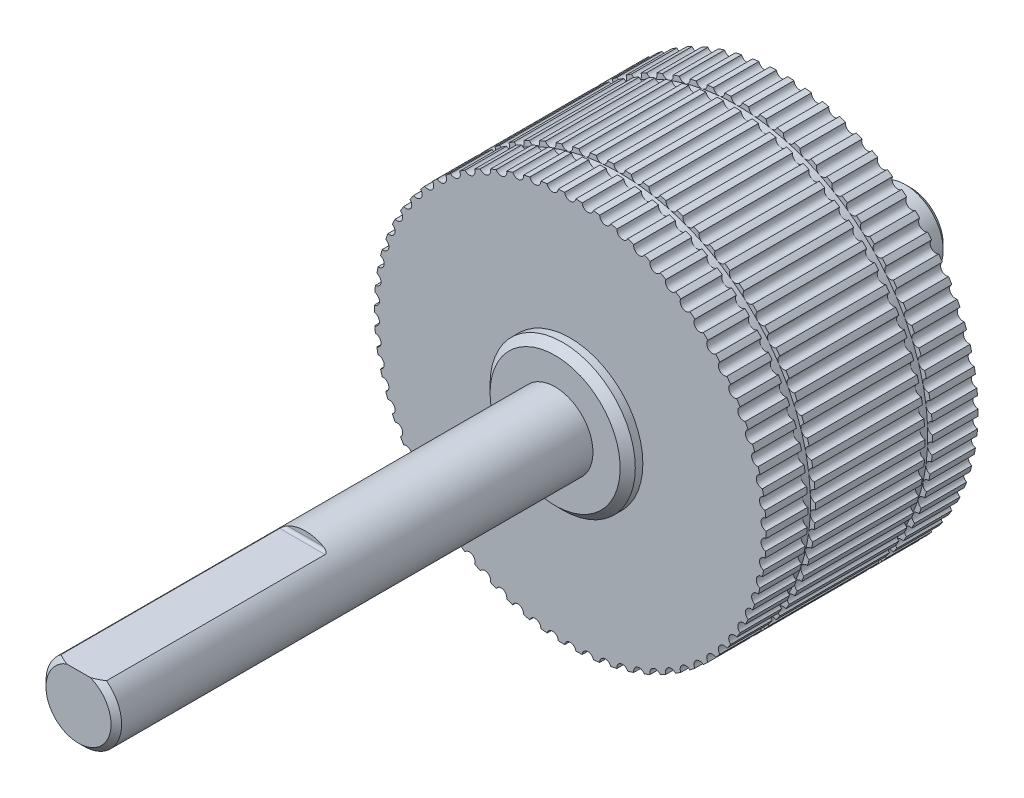
from build123d import *

# Parameters (mm, degrees)
CHAMFER1_SIZE            = 0.5
SKETCH3_R                = 0.375
CUT_EXTRUDE1_DEPTH       = 14
CIRPATTERN1_COUNT        = 70
CUT_EXTRUDE2_START       = -3
SKETCH4_R                = 13
SKETCH4_R_2              = 12.625
CUT_EXTRUDE2_DEPTH       = 0.25
LPATTERN1_COUNT          = 2
LPATTERN1_PITCH          = 7.75
CUT_EXTRUDE3_START       = -14
SKETCH9_R                = 13
SKETCH9_R_2              = 12.95
CUT_EXTRUDE3_DEPTH       = 14
BOSS_EXTRUDE1_DEPTH      = 39.5
BOSS_EXTRUDE1_DEPTH_BACK = 15.5
SKETCH10_R               = 2.5
CHAMFER2_SIZE            = 0.35
SKETCH11_W               = 5
SKETCH11_H               = 0.5
CUT_EXTRUDE4_DEPTH       = 15
FILLET1_R                = 0.2


with BuildPart() as part:
    # Sketch2 → Revolve1 (revolve)
    with BuildSketch(Plane(origin=(0, 0, 0), x_dir=(0, 0, -1), z_dir=(1, 0, 0)), mode=Mode.PRIVATE) as revolve1_sk:
        Polygon((-7, 4.8), (-7, 13), (7, 13), (7, 4.8), (8, 4.8), (8, 2.5), (7, 2.5), (-7, 2.5), (-8, 2.5), (-8, 4.8), align=None)
    revolve(revolve1_sk.sketch.rotate(Axis((0, 0, 0), (0, 0, -1)), 90), axis=Axis((0, 0, 0), (0, 0, -1)))

    # Chamfer1
    chamfer1_edges = [part.edges().sort_by_distance(p)[0] for p in [
        (-4.8, 0, -8),
        (-4.8, 0, 8),
    ]]
    chamfer(chamfer1_edges, length=CHAMFER1_SIZE)

    # Sketch3 → Cut-Extrude1 (cut)
    with BuildSketch(Plane.XY.offset(7)):
        with Locations((0, 13)):
            Circle(SKETCH3_R)
    cut_extrude1 = extrude(amount=-CUT_EXTRUDE1_DEPTH, mode=Mode.SUBTRACT)

    # CirPattern1: Cut-Extrude1 ×70 about axis
    cirpattern1_axis = Axis((0, 0, 0), (0, 0, 1))
    for i in range(1, CIRPATTERN1_COUNT):
        add(cut_extrude1.rotate(cirpattern1_axis, i * 360 / CIRPATTERN1_COUNT), mode=Mode.SUBTRACT)

    # Sketch4 → Cut-Extrude2 (cut, symmetric)
    with BuildSketch(Plane.XY.offset(7).offset(CUT_EXTRUDE2_START)):
        Circle(SKETCH4_R)
        with Locations(Location((0, 0, 0), (0, 0, 357.428571429))):
            Circle(SKETCH4_R_2, mode=Mode.SUBTRACT)
    cut_extrude2 = extrude(amount=CUT_EXTRUDE2_DEPTH, both=True, mode=Mode.SUBTRACT)

    # LPattern1: Cut-Extrude2 ×2
    with Locations(*[(0, 0, -i * LPATTERN1_PITCH) for i in range(1, LPATTERN1_COUNT)]):
        add(cut_extrude2, mode=Mode.SUBTRACT)

    # Sketch9 → Cut-Extrude3 (cut)
    with BuildSketch(Plane.XY.offset(7).offset(CUT_EXTRUDE3_START)):
        Circle(SKETCH9_R)
        Circle(SKETCH9_R_2, mode=Mode.SUBTRACT)
    extrude(amount=CUT_EXTRUDE3_DEPTH, mode=Mode.SUBTRACT)


with BuildPart() as body_2:
    # Sketch10 → Boss-Extrude1 (new, two sides: drawn at the far end of the back side and taken through both)
    with BuildSketch(Plane.XY.offset(-BOSS_EXTRUDE1_DEPTH_BACK)):
        Circle(SKETCH10_R)
    extrude(amount=BOSS_EXTRUDE1_DEPTH + BOSS_EXTRUDE1_DEPTH_BACK)

    # Chamfer2
    chamfer2_edges = [body_2.edges().sort_by_distance(p)[0] for p in [
        (-2.5, 0, -15.5),
        (-2.5, 0, 39.5),
    ]]
    chamfer(chamfer2_edges, length=CHAMFER2_SIZE)

    # Sketch11 → Cut-Extrude4 (cut)
    with BuildSketch(Plane.XY.offset(39.5)):
        with Locations((0, 2.25)):
            Rectangle(SKETCH11_W, SKETCH11_H)
    extrude(amount=-CUT_EXTRUDE4_DEPTH, mode=Mode.SUBTRACT)

    # Fillet1
    fillet1_edges = [body_2.edges().sort_by_distance(p)[0] for p in [
        (0, 2, 24.5),
    ]]
    fillet(fillet1_edges, radius=FILLET1_R)


solid = Compound([part.part, body_2.part])
